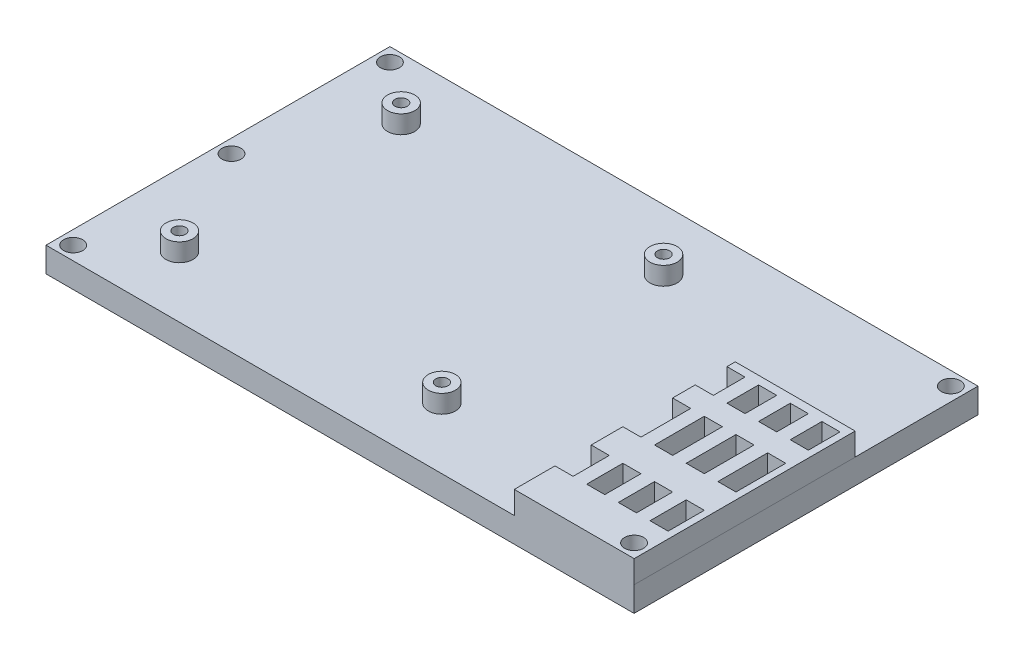
from build123d import *

# Parameters (mm, degrees)
BASES_W                         = 85
BASES_H                         = 56
BASE_DEPTH                      = 0.8
M2_5_CLEARANCE_HOLE_D           = 2.7
FASTENERAREA_START              = -0.01
FASTENERAREAS_R                 = 3
FASTENERAREAS_R_2               = 1.35
FASTENERAREA_DEPTH              = 0.01
FASTENERAREAS_2_R               = 3
FASTENERAREAS_2_R_2             = 1.35
BOSS_EXTRUDE1_DEPTH             = 4
BOSS_EXTRUDE1_2_DEPTH           = 4
HLP_START                       = 0.8
HLP_FASTENERHOLES_OUTLINE_R     = 3
HLP_FASTENERHOLES_OUTLINE_R_2   = 1.35
HLP_FASTENERHOLES_DEPTH         = 4
HLP_FASTENERHOLES_2_OUTLINE_R   = 3
HLP_FASTENERHOLES_2_OUTLINE_R_2 = 1.35
HLP_FASTENERHOLES_2_DEPTH       = 4
HLP_START_2                     = -2
HLP_FASTENERHOLES_3_OUTLINE_R   = 1.35
HLP_FASTENERHOLES_3_DEPTH       = 4
HLP_START_3                     = 0.79
HLP_FASTENERHOLES_4_OUTLINE_R   = 3
HLP_FASTENERHOLES_4_OUTLINE_R_2 = 1.35
HLP_FASTENERHOLES_4_DEPTH       = 1.21
SKETCH4_R                       = 2.1
BOSS_EXTRUDE2_DEPTH             = 5.5
SKETCH7_W                       = 85
SKETCH7_H                       = 56
CUT_EXTRUDE4_DEPTH              = 3
CUT_EXTRUDE5_DEPTH              = 85.244641278
CUT_EXTRUDE5_DEPTH_BACK         = 85.244641278
SKETCH8_R                       = 1.35
SKETCH9_W                       = 26.5
SKETCH9_H                       = 48.839975475
BOSS_EXTRUDE3_DEPTH             = 5
SKETCH12_R                      = 2.1
SKETCH12_W                      = 4
SKETCH12_H                      = 11
SKETCH12_H_2                    = 8
SKETCH12_H_3                    = 7
CUT_EXTRUDE6_DEPTH              = 85.737106223
BOSS_EXTRUDE4_DEPTH             = 3


with BuildPart() as part:
    # BaseS → Base (new, symmetric)
    with BuildSketch(Plane(origin=(0, 0, 0), x_dir=(1, 0, 0), z_dir=(0, 1, 0))):
        Rectangle(BASES_W, BASES_H)
    extrude(amount=BASE_DEPTH, both=True)

    # M2.5 Clearance Hole (through all)
    with Locations(Plane(origin=(0, 0.8, 0), x_dir=(1, 0, 0), z_dir=(0, 1, 0))):
        with Locations((-39, 24.5), (-39, -24.5)):
            Hole(M2_5_CLEARANCE_HOLE_D / 2)

    # FastenerAreaS → FastenerArea (cut)
    # profile 1 of 2: a face of its own
    with BuildSketch(Plane(origin=(0, 0.8, 0), x_dir=(1, 0, 0), z_dir=(0, 1, 0)).offset(FASTENERAREA_START)):
        with Locations(Location((-39, -24.5, 0), (0, 0, 270))):
            Circle(FASTENERAREAS_R)
        with Locations(Location((-39, -24.5, 0), (0, 0, 270))):
            Circle(FASTENERAREAS_R_2, mode=Mode.SUBTRACT)
    # profile 2 of 2: a face of its own
    with BuildSketch(Plane(origin=(0, 0.8, 0), x_dir=(1, 0, 0), z_dir=(0, 1, 0)).offset(FASTENERAREA_START)):
        with Locations(Location((-39, 24.5, 0), (0, 0, 270))):
            Circle(FASTENERAREAS_R)
        with Locations(Location((-39, 24.5, 0), (0, 0, 270))):
            Circle(FASTENERAREAS_R_2, mode=Mode.SUBTRACT)
    fastenerarea = extrude(amount=FASTENERAREA_DEPTH, mode=Mode.SUBTRACT)

    # HLP FastenerHoles 3 outline → HLP FastenerHoles 3 (cut)
    with BuildSketch(Plane(origin=(0, 0, 0), x_dir=(1, 0, 0), z_dir=(0, 1, 0)).offset(HLP_START_2)):
        with Locations((19, -24.5)):
            Circle(HLP_FASTENERHOLES_3_OUTLINE_R)
        with Locations((19, 24.5)):
            Circle(HLP_FASTENERHOLES_3_OUTLINE_R)
    hlp_fastenerholes_3 = extrude(amount=HLP_FASTENERHOLES_3_DEPTH, mode=Mode.SUBTRACT)

    # HLP FastenerHoles 4 outline → HLP FastenerHoles 4 (cut)
    # profile 1 of 2: a face of its own
    with BuildSketch(Plane(origin=(0, 0, 0), x_dir=(1, 0, 0), z_dir=(0, 1, 0)).offset(HLP_START_3)):
        with Locations((19, 24.5)):
            Circle(HLP_FASTENERHOLES_4_OUTLINE_R)
        with Locations((19, 24.5)):
            Circle(HLP_FASTENERHOLES_4_OUTLINE_R_2, mode=Mode.SUBTRACT)
    # profile 2 of 2: a face of its own
    with BuildSketch(Plane(origin=(0, 0, 0), x_dir=(1, 0, 0), z_dir=(0, 1, 0)).offset(HLP_START_3)):
        with Locations((19, -24.5)):
            Circle(HLP_FASTENERHOLES_4_OUTLINE_R)
        with Locations((19, -24.5)):
            Circle(HLP_FASTENERHOLES_4_OUTLINE_R_2, mode=Mode.SUBTRACT)
    hlp_fastenerholes_4 = extrude(amount=HLP_FASTENERHOLES_4_DEPTH, mode=Mode.SUBTRACT)


with BuildPart() as body_2:
    # FastenerAreaS<2> → Boss-Extrude1 (new body)
    with BuildSketch(Plane(origin=(0, 0.8, 0), x_dir=(1, 0, 0), z_dir=(0, 1, 0))):
        with Locations(Location((-39, -24.5, 0), (0, 0, 270))):
            Circle(FASTENERAREAS_2_R)
        with Locations(Location((-39, -24.5, 0), (0, 0, 270))):
            Circle(FASTENERAREAS_2_R_2, mode=Mode.SUBTRACT)
    extrude(amount=BOSS_EXTRUDE1_DEPTH)


with BuildPart() as body_3:
    # FastenerAreaS<2> → Boss-Extrude1 2 (new body)
    with BuildSketch(Plane(origin=(0, 0.8, 0), x_dir=(1, 0, 0), z_dir=(0, 1, 0))):
        with Locations(Location((-39, 24.5, 0), (0, 0, 270))):
            Circle(FASTENERAREAS_2_R)
        with Locations(Location((-39, 24.5, 0), (0, 0, 270))):
            Circle(FASTENERAREAS_2_R_2, mode=Mode.SUBTRACT)
    extrude(amount=BOSS_EXTRUDE1_2_DEPTH)


with BuildPart() as body_4:
    # HLP FastenerHoles: read off the stored shape, not the designer's step
    # HLP FastenerHoles outline → HLP FastenerHoles (new body)
    with BuildSketch(Plane(origin=(0, 0, 0), x_dir=(1, 0, 0), z_dir=(0, 1, 0)).offset(HLP_START)):
        with Locations((19, 24.5)):
            Circle(HLP_FASTENERHOLES_OUTLINE_R)
        with Locations((19, 24.5)):
            Circle(HLP_FASTENERHOLES_OUTLINE_R_2, mode=Mode.SUBTRACT)
    hlp_fastenerholes = extrude(amount=HLP_FASTENERHOLES_DEPTH)


with BuildPart() as body_5:
    # HLP FastenerHoles 2 outline → HLP FastenerHoles 2 (new body)
    with BuildSketch(Plane(origin=(0, 0, 0), x_dir=(1, 0, 0), z_dir=(0, 1, 0)).offset(HLP_START)):
        with Locations((19, -24.5)):
            Circle(HLP_FASTENERHOLES_2_OUTLINE_R)
        with Locations((19, -24.5)):
            Circle(HLP_FASTENERHOLES_2_OUTLINE_R_2, mode=Mode.SUBTRACT)
    hlp_fastenerholes_2 = extrude(amount=HLP_FASTENERHOLES_2_DEPTH)


with BuildPart() as part_1:
    add(part.part)

    # VM FA: FastenerArea, HLP FastenerHoles, HLP FastenerHoles 2, HLP FastenerHoles 3, HLP FastenerHoles 4 across plane
    add(fastenerarea.mirror(Plane.ZX), mode=Mode.SUBTRACT)
    add(hlp_fastenerholes.mirror(Plane.ZX), mode=Mode.SUBTRACT)
    add(hlp_fastenerholes_2.mirror(Plane.ZX), mode=Mode.SUBTRACT)
    add(hlp_fastenerholes_3.mirror(Plane.ZX), mode=Mode.SUBTRACT)
    add(hlp_fastenerholes_4.mirror(Plane.ZX), mode=Mode.SUBTRACT)

    # Sketch4 → Boss-Extrude2 (add)
    with BuildSketch(Plane.XZ.offset(-0.8)):
        Polygon((55.021462019, -38.014828304), (-55, -38.014828304), (-55, 38), (54.978546352, 38), (74.978546352, 38), (74.978546352, -38.014828304), align=None)
        with Locations(Location((-52, 35, 0), (0, 0, 270))):
            Circle(SKETCH4_R, mode=Mode.SUBTRACT)
        with Locations(Location((-52, -35.014828304, 0), (0, 0, 270))):
            Circle(SKETCH4_R, mode=Mode.SUBTRACT)
        with Locations(Location((71.978546352, -35.014828304, 0), (0, 0, 270))):
            Circle(SKETCH4_R, mode=Mode.SUBTRACT)
        with Locations(Location((71.978546352, 35, 0), (0, 0, 270))):
            Circle(SKETCH4_R, mode=Mode.SUBTRACT)
        with Locations(Location((-52, 0, 0), (0, 0, 270))):
            Circle(SKETCH4_R, mode=Mode.SUBTRACT)
    extrude(amount=BOSS_EXTRUDE2_DEPTH)

    # Sketch7 → Cut-Extrude4 (cut)
    with BuildSketch(Plane.XZ.offset(4.7)):
        Rectangle(SKETCH7_W, SKETCH7_H)
    extrude(amount=-CUT_EXTRUDE4_DEPTH, mode=Mode.SUBTRACT)

    # Sketch8 → Cut-Extrude5 (cut, two sides: drawn at the far end of the back side and taken through both)
    with BuildSketch(Plane(origin=(0, 0.8, 0), x_dir=(1, 0, 0), z_dir=(0, 1, 0)).offset(-CUT_EXTRUDE5_DEPTH_BACK)):
        with Locations(Location((19, -24.5, 0), (0, 0, 270))):
            Circle(SKETCH8_R)
        with Locations(Location((19, 24.5, 0), (0, 0, 270))):
            Circle(SKETCH8_R)
        with Locations(Location((-39, 24.5, 0), (0, 0, 270))):
            Circle(SKETCH8_R)
        with Locations(Location((-39, -24.5, 0), (0, 0, 270))):
            Circle(SKETCH8_R)
    extrude(amount=CUT_EXTRUDE5_DEPTH + CUT_EXTRUDE5_DEPTH_BACK, mode=Mode.SUBTRACT)

    # Sketch9 → Boss-Extrude3 (add)
    with BuildSketch(Plane(origin=(0, 0.8, 0), x_dir=(1, 0, 0), z_dir=(0, 1, 0))):
        with Locations((61.75, -13.580012262)):
            Rectangle(SKETCH9_W, SKETCH9_H)
    extrude(amount=BOSS_EXTRUDE3_DEPTH)

    # Sketch12 → Cut-Extrude6 (cut, through all)
    with BuildSketch(Plane.XZ.offset(4.7)):
        with Locations(Location((71.978546352, 35, 0), (0, 0, 270))):
            Circle(SKETCH12_R)
        with Locations(Location((71.978546352, -35.014828304, 0), (0, 0, 270))):
            Circle(SKETCH12_R)
        with Locations((57.5, 8.5)):
            Rectangle(SKETCH12_W, SKETCH12_H)
        with Locations((50.5, 8.5)):
            Rectangle(SKETCH12_W, SKETCH12_H)
        with Locations((64.5, 8.5)):
            Rectangle(SKETCH12_W, SKETCH12_H)
        with Locations((71.5, 8.5)):
            Rectangle(SKETCH12_W, SKETCH12_H)
        with Locations((50.5, 25)):
            Rectangle(SKETCH12_W, SKETCH12_H_2)
        with Locations((57.5, 25)):
            Rectangle(SKETCH12_W, SKETCH12_H_2)
        with Locations((64.5, 25)):
            Rectangle(SKETCH12_W, SKETCH12_H_2)
        with Locations((71.5, 25)):
            Rectangle(SKETCH12_W, SKETCH12_H_2)
        with Locations((50.5, -5.5)):
            Rectangle(SKETCH12_W, SKETCH12_H_3)
        with Locations((57.5, -5.5)):
            Rectangle(SKETCH12_W, SKETCH12_H_3)
        with Locations((64.5, -5.5)):
            Rectangle(SKETCH12_W, SKETCH12_H_3)
        with Locations((71.5, -5.5)):
            Rectangle(SKETCH12_W, SKETCH12_H_3)
    extrude(amount=-CUT_EXTRUDE6_DEPTH, mode=Mode.SUBTRACT)

    # Sketch13 → Boss-Extrude4 (add)
    with BuildSketch(Plane.XZ.offset(1.7)):
        Polygon((-42.5, -15), (-42.5, 15), (-17.5, 15), (-17.5, 28), (15.5, 28), (15.5, 15), (42.5, 15), (42.5, -15), (15.5, -15), (15.5, -28), (-17.5, -28), (-17.5, -15), align=None)
    extrude(amount=BOSS_EXTRUDE4_DEPTH)


solid = Compound([body_2.part, body_3.part, body_4.part, body_5.part, part_1.part])
